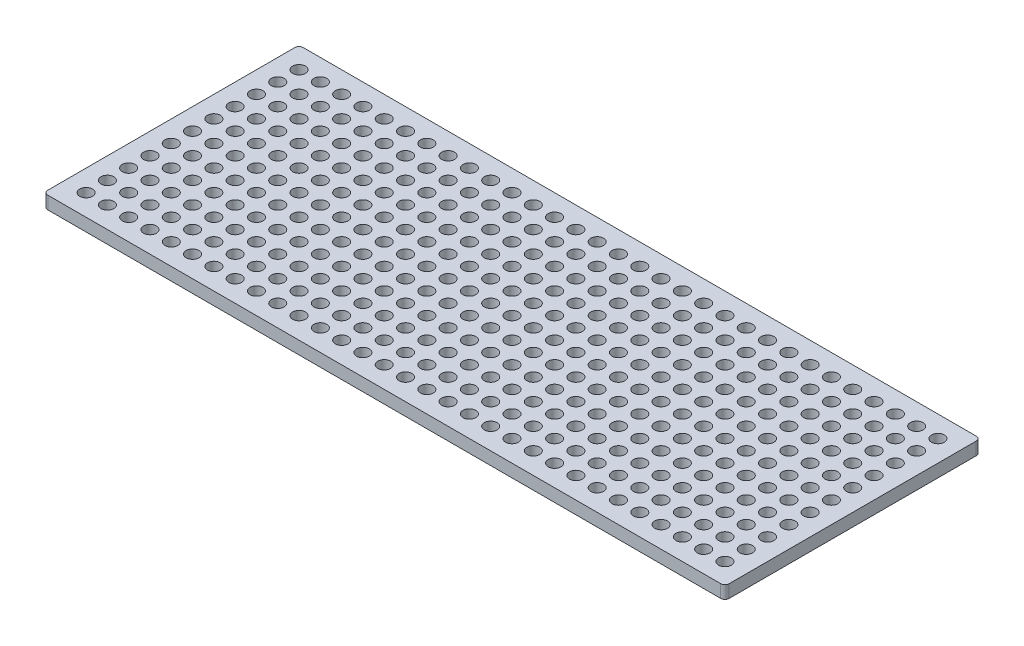
from build123d import *

# Parameters (mm, degrees)
SKETCH1_W           = 160
SKETCH1_H           = 60
SKETCH1_R           = 1.5
BOSS_EXTRUDE1_DEPTH = 3
FILLET2_R           = 1
FILLET3_R           = 1
FILLET4_R           = 1
FILLET5_R           = 1


with BuildPart() as part:
    # Sketch1 → Boss-Extrude1 (new body)
    with BuildSketch(Plane(origin=(0, 0, 0), x_dir=(1, 0, 0), z_dir=(0, 1, 0))):
        Rectangle(SKETCH1_W, SKETCH1_H)
        with Locations((-75, 25)):
            Circle(SKETCH1_R, mode=Mode.SUBTRACT)
        with Locations((-70, 25)):
            Circle(SKETCH1_R, mode=Mode.SUBTRACT)
        with Locations((-65, 25)):
            Circle(SKETCH1_R, mode=Mode.SUBTRACT)
        with Locations((-60, 25)):
            Circle(SKETCH1_R, mode=Mode.SUBTRACT)
        with Locations((-55, 25)):
            Circle(SKETCH1_R, mode=Mode.SUBTRACT)
        with Locations((-50, 25)):
            Circle(SKETCH1_R, mode=Mode.SUBTRACT)
        with Locations((-45, 25)):
            Circle(SKETCH1_R, mode=Mode.SUBTRACT)
        with Locations((-40, 25)):
            Circle(SKETCH1_R, mode=Mode.SUBTRACT)
        with Locations((-35, 25)):
            Circle(SKETCH1_R, mode=Mode.SUBTRACT)
        with Locations((-30, 25)):
            Circle(SKETCH1_R, mode=Mode.SUBTRACT)
        with Locations((-25, 25)):
            Circle(SKETCH1_R, mode=Mode.SUBTRACT)
        with Locations((-20, 25)):
            Circle(SKETCH1_R, mode=Mode.SUBTRACT)
        with Locations((-15, 25)):
            Circle(SKETCH1_R, mode=Mode.SUBTRACT)
        with Locations((-10, 25)):
            Circle(SKETCH1_R, mode=Mode.SUBTRACT)
        with Locations((-5, 25)):
            Circle(SKETCH1_R, mode=Mode.SUBTRACT)
        with Locations((0, 25)):
            Circle(SKETCH1_R, mode=Mode.SUBTRACT)
        with Locations((5, 25)):
            Circle(SKETCH1_R, mode=Mode.SUBTRACT)
        with Locations((10, 25)):
            Circle(SKETCH1_R, mode=Mode.SUBTRACT)
        with Locations((15, 25)):
            Circle(SKETCH1_R, mode=Mode.SUBTRACT)
        with Locations((20, 25)):
            Circle(SKETCH1_R, mode=Mode.SUBTRACT)
        with Locations((25, 25)):
            Circle(SKETCH1_R, mode=Mode.SUBTRACT)
        with Locations((30, 25)):
            Circle(SKETCH1_R, mode=Mode.SUBTRACT)
        with Locations((35, 25)):
            Circle(SKETCH1_R, mode=Mode.SUBTRACT)
        with Locations((40, 25)):
            Circle(SKETCH1_R, mode=Mode.SUBTRACT)
        with Locations((45, 25)):
            Circle(SKETCH1_R, mode=Mode.SUBTRACT)
        with Locations((50, 25)):
            Circle(SKETCH1_R, mode=Mode.SUBTRACT)
        with Locations((55, 25)):
            Circle(SKETCH1_R, mode=Mode.SUBTRACT)
        with Locations((60, 25)):
            Circle(SKETCH1_R, mode=Mode.SUBTRACT)
        with Locations((65, 25)):
            Circle(SKETCH1_R, mode=Mode.SUBTRACT)
        with Locations((70, 25)):
            Circle(SKETCH1_R, mode=Mode.SUBTRACT)
        with Locations((75, 25)):
            Circle(SKETCH1_R, mode=Mode.SUBTRACT)
        with Locations((-75, 20)):
            Circle(SKETCH1_R, mode=Mode.SUBTRACT)
        with Locations((-75, 15)):
            Circle(SKETCH1_R, mode=Mode.SUBTRACT)
        with Locations((-75, 10)):
            Circle(SKETCH1_R, mode=Mode.SUBTRACT)
        with Locations((-75, 5)):
            Circle(SKETCH1_R, mode=Mode.SUBTRACT)
        with Locations((-75, 0)):
            Circle(SKETCH1_R, mode=Mode.SUBTRACT)
        with Locations((-75, -5)):
            Circle(SKETCH1_R, mode=Mode.SUBTRACT)
        with Locations((-75, -10)):
            Circle(SKETCH1_R, mode=Mode.SUBTRACT)
        with Locations((-75, -15)):
            Circle(SKETCH1_R, mode=Mode.SUBTRACT)
        with Locations((-75, -20)):
            Circle(SKETCH1_R, mode=Mode.SUBTRACT)
        with Locations((-75, -25)):
            Circle(SKETCH1_R, mode=Mode.SUBTRACT)
        with Locations((-70, 20)):
            Circle(SKETCH1_R, mode=Mode.SUBTRACT)
        with Locations((-70, 10)):
            Circle(SKETCH1_R, mode=Mode.SUBTRACT)
        with Locations((-70, 5)):
            Circle(SKETCH1_R, mode=Mode.SUBTRACT)
        with Locations((-70, 0)):
            Circle(SKETCH1_R, mode=Mode.SUBTRACT)
        with Locations((-70, -5)):
            Circle(SKETCH1_R, mode=Mode.SUBTRACT)
        with Locations((-70, -10)):
            Circle(SKETCH1_R, mode=Mode.SUBTRACT)
        with Locations((-70, -15)):
            Circle(SKETCH1_R, mode=Mode.SUBTRACT)
        with Locations((-70, -20)):
            Circle(SKETCH1_R, mode=Mode.SUBTRACT)
        with Locations((-70, -25)):
            Circle(SKETCH1_R, mode=Mode.SUBTRACT)
        with Locations((-65, 20)):
            Circle(SKETCH1_R, mode=Mode.SUBTRACT)
        with Locations((-65, 10)):
            Circle(SKETCH1_R, mode=Mode.SUBTRACT)
        with Locations((-65, 5)):
            Circle(SKETCH1_R, mode=Mode.SUBTRACT)
        with Locations((-65, 0)):
            Circle(SKETCH1_R, mode=Mode.SUBTRACT)
        with Locations((-65, -5)):
            Circle(SKETCH1_R, mode=Mode.SUBTRACT)
        with Locations((-65, -10)):
            Circle(SKETCH1_R, mode=Mode.SUBTRACT)
        with Locations((-65, -15)):
            Circle(SKETCH1_R, mode=Mode.SUBTRACT)
        with Locations((-65, -20)):
            Circle(SKETCH1_R, mode=Mode.SUBTRACT)
        with Locations((-65, -25)):
            Circle(SKETCH1_R, mode=Mode.SUBTRACT)
        with Locations((-60, 20)):
            Circle(SKETCH1_R, mode=Mode.SUBTRACT)
        with Locations((-60, 10)):
            Circle(SKETCH1_R, mode=Mode.SUBTRACT)
        with Locations((-60, 5)):
            Circle(SKETCH1_R, mode=Mode.SUBTRACT)
        with Locations((-60, 0)):
            Circle(SKETCH1_R, mode=Mode.SUBTRACT)
        with Locations((-60, -5)):
            Circle(SKETCH1_R, mode=Mode.SUBTRACT)
        with Locations((-60, -10)):
            Circle(SKETCH1_R, mode=Mode.SUBTRACT)
        with Locations((-60, -15)):
            Circle(SKETCH1_R, mode=Mode.SUBTRACT)
        with Locations((-60, -20)):
            Circle(SKETCH1_R, mode=Mode.SUBTRACT)
        with Locations((-60, -25)):
            Circle(SKETCH1_R, mode=Mode.SUBTRACT)
        with Locations((-55, 20)):
            Circle(SKETCH1_R, mode=Mode.SUBTRACT)
        with Locations((-55, 10)):
            Circle(SKETCH1_R, mode=Mode.SUBTRACT)
        with Locations((-55, 5)):
            Circle(SKETCH1_R, mode=Mode.SUBTRACT)
        with Locations((-55, 0)):
            Circle(SKETCH1_R, mode=Mode.SUBTRACT)
        with Locations((-55, -5)):
            Circle(SKETCH1_R, mode=Mode.SUBTRACT)
        with Locations((-55, -10)):
            Circle(SKETCH1_R, mode=Mode.SUBTRACT)
        with Locations((-55, -15)):
            Circle(SKETCH1_R, mode=Mode.SUBTRACT)
        with Locations((-55, -20)):
            Circle(SKETCH1_R, mode=Mode.SUBTRACT)
        with Locations((-55, -25)):
            Circle(SKETCH1_R, mode=Mode.SUBTRACT)
        with Locations((-50, 20)):
            Circle(SKETCH1_R, mode=Mode.SUBTRACT)
        with Locations((-50, 10)):
            Circle(SKETCH1_R, mode=Mode.SUBTRACT)
        with Locations((-50, 5)):
            Circle(SKETCH1_R, mode=Mode.SUBTRACT)
        with Locations((-50, 0)):
            Circle(SKETCH1_R, mode=Mode.SUBTRACT)
        with Locations((-50, -5)):
            Circle(SKETCH1_R, mode=Mode.SUBTRACT)
        with Locations((-50, -10)):
            Circle(SKETCH1_R, mode=Mode.SUBTRACT)
        with Locations((-50, -15)):
            Circle(SKETCH1_R, mode=Mode.SUBTRACT)
        with Locations((-50, -20)):
            Circle(SKETCH1_R, mode=Mode.SUBTRACT)
        with Locations((-50, -25)):
            Circle(SKETCH1_R, mode=Mode.SUBTRACT)
        with Locations((-45, 20)):
            Circle(SKETCH1_R, mode=Mode.SUBTRACT)
        with Locations((-45, 10)):
            Circle(SKETCH1_R, mode=Mode.SUBTRACT)
        with Locations((-45, 5)):
            Circle(SKETCH1_R, mode=Mode.SUBTRACT)
        with Locations((-45, 0)):
            Circle(SKETCH1_R, mode=Mode.SUBTRACT)
        with Locations((-45, -5)):
            Circle(SKETCH1_R, mode=Mode.SUBTRACT)
        with Locations((-45, -10)):
            Circle(SKETCH1_R, mode=Mode.SUBTRACT)
        with Locations((-45, -15)):
            Circle(SKETCH1_R, mode=Mode.SUBTRACT)
        with Locations((-45, -20)):
            Circle(SKETCH1_R, mode=Mode.SUBTRACT)
        with Locations((-45, -25)):
            Circle(SKETCH1_R, mode=Mode.SUBTRACT)
        with Locations((-40, 20)):
            Circle(SKETCH1_R, mode=Mode.SUBTRACT)
        with Locations((-40, 10)):
            Circle(SKETCH1_R, mode=Mode.SUBTRACT)
        with Locations((-40, 5)):
            Circle(SKETCH1_R, mode=Mode.SUBTRACT)
        with Locations((-40, 0)):
            Circle(SKETCH1_R, mode=Mode.SUBTRACT)
        with Locations((-40, -5)):
            Circle(SKETCH1_R, mode=Mode.SUBTRACT)
        with Locations((-40, -10)):
            Circle(SKETCH1_R, mode=Mode.SUBTRACT)
        with Locations((-40, -15)):
            Circle(SKETCH1_R, mode=Mode.SUBTRACT)
        with Locations((-40, -20)):
            Circle(SKETCH1_R, mode=Mode.SUBTRACT)
        with Locations((-40, -25)):
            Circle(SKETCH1_R, mode=Mode.SUBTRACT)
        with Locations((-35, 20)):
            Circle(SKETCH1_R, mode=Mode.SUBTRACT)
        with Locations((-35, 10)):
            Circle(SKETCH1_R, mode=Mode.SUBTRACT)
        with Locations((-35, 5)):
            Circle(SKETCH1_R, mode=Mode.SUBTRACT)
        with Locations((-35, 0)):
            Circle(SKETCH1_R, mode=Mode.SUBTRACT)
        with Locations((-35, -5)):
            Circle(SKETCH1_R, mode=Mode.SUBTRACT)
        with Locations((-35, -10)):
            Circle(SKETCH1_R, mode=Mode.SUBTRACT)
        with Locations((-35, -15)):
            Circle(SKETCH1_R, mode=Mode.SUBTRACT)
        with Locations((-35, -20)):
            Circle(SKETCH1_R, mode=Mode.SUBTRACT)
        with Locations((-35, -25)):
            Circle(SKETCH1_R, mode=Mode.SUBTRACT)
        with Locations((-30, 20)):
            Circle(SKETCH1_R, mode=Mode.SUBTRACT)
        with Locations((-30, 10)):
            Circle(SKETCH1_R, mode=Mode.SUBTRACT)
        with Locations((-30, 5)):
            Circle(SKETCH1_R, mode=Mode.SUBTRACT)
        with Locations((-30, 0)):
            Circle(SKETCH1_R, mode=Mode.SUBTRACT)
        with Locations((-30, -5)):
            Circle(SKETCH1_R, mode=Mode.SUBTRACT)
        with Locations((-30, -10)):
            Circle(SKETCH1_R, mode=Mode.SUBTRACT)
        with Locations((-30, -15)):
            Circle(SKETCH1_R, mode=Mode.SUBTRACT)
        with Locations((-30, -20)):
            Circle(SKETCH1_R, mode=Mode.SUBTRACT)
        with Locations((-30, -25)):
            Circle(SKETCH1_R, mode=Mode.SUBTRACT)
        with Locations((-25, 20)):
            Circle(SKETCH1_R, mode=Mode.SUBTRACT)
        with Locations((-25, 10)):
            Circle(SKETCH1_R, mode=Mode.SUBTRACT)
        with Locations((-25, 5)):
            Circle(SKETCH1_R, mode=Mode.SUBTRACT)
        with Locations((-25, 0)):
            Circle(SKETCH1_R, mode=Mode.SUBTRACT)
        with Locations((-25, -5)):
            Circle(SKETCH1_R, mode=Mode.SUBTRACT)
        with Locations((-25, -10)):
            Circle(SKETCH1_R, mode=Mode.SUBTRACT)
        with Locations((-25, -15)):
            Circle(SKETCH1_R, mode=Mode.SUBTRACT)
        with Locations((-25, -20)):
            Circle(SKETCH1_R, mode=Mode.SUBTRACT)
        with Locations((-25, -25)):
            Circle(SKETCH1_R, mode=Mode.SUBTRACT)
        with Locations((-20, 20)):
            Circle(SKETCH1_R, mode=Mode.SUBTRACT)
        with Locations((-20, 10)):
            Circle(SKETCH1_R, mode=Mode.SUBTRACT)
        with Locations((-20, 5)):
            Circle(SKETCH1_R, mode=Mode.SUBTRACT)
        with Locations((-20, 0)):
            Circle(SKETCH1_R, mode=Mode.SUBTRACT)
        with Locations((-20, -5)):
            Circle(SKETCH1_R, mode=Mode.SUBTRACT)
        with Locations((-20, -10)):
            Circle(SKETCH1_R, mode=Mode.SUBTRACT)
        with Locations((-20, -15)):
            Circle(SKETCH1_R, mode=Mode.SUBTRACT)
        with Locations((-20, -20)):
            Circle(SKETCH1_R, mode=Mode.SUBTRACT)
        with Locations((-20, -25)):
            Circle(SKETCH1_R, mode=Mode.SUBTRACT)
        with Locations((-15, 20)):
            Circle(SKETCH1_R, mode=Mode.SUBTRACT)
        with Locations((-15, 10)):
            Circle(SKETCH1_R, mode=Mode.SUBTRACT)
        with Locations((-15, 5)):
            Circle(SKETCH1_R, mode=Mode.SUBTRACT)
        with Locations((-15, 0)):
            Circle(SKETCH1_R, mode=Mode.SUBTRACT)
        with Locations((-15, -5)):
            Circle(SKETCH1_R, mode=Mode.SUBTRACT)
        with Locations((-15, -10)):
            Circle(SKETCH1_R, mode=Mode.SUBTRACT)
        with Locations((-15, -15)):
            Circle(SKETCH1_R, mode=Mode.SUBTRACT)
        with Locations((-15, -20)):
            Circle(SKETCH1_R, mode=Mode.SUBTRACT)
        with Locations((-15, -25)):
            Circle(SKETCH1_R, mode=Mode.SUBTRACT)
        with Locations((-10, 20)):
            Circle(SKETCH1_R, mode=Mode.SUBTRACT)
        with Locations((-10, 10)):
            Circle(SKETCH1_R, mode=Mode.SUBTRACT)
        with Locations((-10, 5)):
            Circle(SKETCH1_R, mode=Mode.SUBTRACT)
        with Locations((-10, 0)):
            Circle(SKETCH1_R, mode=Mode.SUBTRACT)
        with Locations((-10, -5)):
            Circle(SKETCH1_R, mode=Mode.SUBTRACT)
        with Locations((-10, -10)):
            Circle(SKETCH1_R, mode=Mode.SUBTRACT)
        with Locations((-10, -15)):
            Circle(SKETCH1_R, mode=Mode.SUBTRACT)
        with Locations((-10, -20)):
            Circle(SKETCH1_R, mode=Mode.SUBTRACT)
        with Locations((-10, -25)):
            Circle(SKETCH1_R, mode=Mode.SUBTRACT)
        with Locations((-5, 20)):
            Circle(SKETCH1_R, mode=Mode.SUBTRACT)
        with Locations((-5, 10)):
            Circle(SKETCH1_R, mode=Mode.SUBTRACT)
        with Locations((-5, 5)):
            Circle(SKETCH1_R, mode=Mode.SUBTRACT)
        with Locations((-5, 0)):
            Circle(SKETCH1_R, mode=Mode.SUBTRACT)
        with Locations((-5, -5)):
            Circle(SKETCH1_R, mode=Mode.SUBTRACT)
        with Locations((-5, -10)):
            Circle(SKETCH1_R, mode=Mode.SUBTRACT)
        with Locations((-5, -15)):
            Circle(SKETCH1_R, mode=Mode.SUBTRACT)
        with Locations((-5, -20)):
            Circle(SKETCH1_R, mode=Mode.SUBTRACT)
        with Locations((-5, -25)):
            Circle(SKETCH1_R, mode=Mode.SUBTRACT)
        with Locations((0, 20)):
            Circle(SKETCH1_R, mode=Mode.SUBTRACT)
        with Locations((0, 10)):
            Circle(SKETCH1_R, mode=Mode.SUBTRACT)
        with Locations((0, 5)):
            Circle(SKETCH1_R, mode=Mode.SUBTRACT)
        Circle(SKETCH1_R, mode=Mode.SUBTRACT)
        with Locations((0, -5)):
            Circle(SKETCH1_R, mode=Mode.SUBTRACT)
        with Locations((0, -10)):
            Circle(SKETCH1_R, mode=Mode.SUBTRACT)
        with Locations((0, -15)):
            Circle(SKETCH1_R, mode=Mode.SUBTRACT)
        with Locations((0, -20)):
            Circle(SKETCH1_R, mode=Mode.SUBTRACT)
        with Locations((0, -25)):
            Circle(SKETCH1_R, mode=Mode.SUBTRACT)
        with Locations((5, 20)):
            Circle(SKETCH1_R, mode=Mode.SUBTRACT)
        with Locations((5, 10)):
            Circle(SKETCH1_R, mode=Mode.SUBTRACT)
        with Locations((5, 5)):
            Circle(SKETCH1_R, mode=Mode.SUBTRACT)
        with Locations((5, 0)):
            Circle(SKETCH1_R, mode=Mode.SUBTRACT)
        with Locations((5, -5)):
            Circle(SKETCH1_R, mode=Mode.SUBTRACT)
        with Locations((5, -10)):
            Circle(SKETCH1_R, mode=Mode.SUBTRACT)
        with Locations((5, -15)):
            Circle(SKETCH1_R, mode=Mode.SUBTRACT)
        with Locations((5, -20)):
            Circle(SKETCH1_R, mode=Mode.SUBTRACT)
        with Locations((5, -25)):
            Circle(SKETCH1_R, mode=Mode.SUBTRACT)
        with Locations((10, 20)):
            Circle(SKETCH1_R, mode=Mode.SUBTRACT)
        with Locations((10, 10)):
            Circle(SKETCH1_R, mode=Mode.SUBTRACT)
        with Locations((10, 5)):
            Circle(SKETCH1_R, mode=Mode.SUBTRACT)
        with Locations((10, 0)):
            Circle(SKETCH1_R, mode=Mode.SUBTRACT)
        with Locations((10, -5)):
            Circle(SKETCH1_R, mode=Mode.SUBTRACT)
        with Locations((10, -10)):
            Circle(SKETCH1_R, mode=Mode.SUBTRACT)
        with Locations((10, -15)):
            Circle(SKETCH1_R, mode=Mode.SUBTRACT)
        with Locations((10, -20)):
            Circle(SKETCH1_R, mode=Mode.SUBTRACT)
        with Locations((10, -25)):
            Circle(SKETCH1_R, mode=Mode.SUBTRACT)
        with Locations((15, 20)):
            Circle(SKETCH1_R, mode=Mode.SUBTRACT)
        with Locations((15, 10)):
            Circle(SKETCH1_R, mode=Mode.SUBTRACT)
        with Locations((15, 5)):
            Circle(SKETCH1_R, mode=Mode.SUBTRACT)
        with Locations((15, 0)):
            Circle(SKETCH1_R, mode=Mode.SUBTRACT)
        with Locations((15, -5)):
            Circle(SKETCH1_R, mode=Mode.SUBTRACT)
        with Locations((15, -10)):
            Circle(SKETCH1_R, mode=Mode.SUBTRACT)
        with Locations((15, -15)):
            Circle(SKETCH1_R, mode=Mode.SUBTRACT)
        with Locations((15, -20)):
            Circle(SKETCH1_R, mode=Mode.SUBTRACT)
        with Locations((15, -25)):
            Circle(SKETCH1_R, mode=Mode.SUBTRACT)
        with Locations((20, 20)):
            Circle(SKETCH1_R, mode=Mode.SUBTRACT)
        with Locations((20, 10)):
            Circle(SKETCH1_R, mode=Mode.SUBTRACT)
        with Locations((20, 5)):
            Circle(SKETCH1_R, mode=Mode.SUBTRACT)
        with Locations((20, 0)):
            Circle(SKETCH1_R, mode=Mode.SUBTRACT)
        with Locations((20, -5)):
            Circle(SKETCH1_R, mode=Mode.SUBTRACT)
        with Locations((20, -10)):
            Circle(SKETCH1_R, mode=Mode.SUBTRACT)
        with Locations((20, -15)):
            Circle(SKETCH1_R, mode=Mode.SUBTRACT)
        with Locations((20, -20)):
            Circle(SKETCH1_R, mode=Mode.SUBTRACT)
        with Locations((20, -25)):
            Circle(SKETCH1_R, mode=Mode.SUBTRACT)
        with Locations((25, 20)):
            Circle(SKETCH1_R, mode=Mode.SUBTRACT)
        with Locations((25, 10)):
            Circle(SKETCH1_R, mode=Mode.SUBTRACT)
        with Locations((25, 5)):
            Circle(SKETCH1_R, mode=Mode.SUBTRACT)
        with Locations((25, 0)):
            Circle(SKETCH1_R, mode=Mode.SUBTRACT)
        with Locations((25, -5)):
            Circle(SKETCH1_R, mode=Mode.SUBTRACT)
        with Locations((25, -10)):
            Circle(SKETCH1_R, mode=Mode.SUBTRACT)
        with Locations((25, -15)):
            Circle(SKETCH1_R, mode=Mode.SUBTRACT)
        with Locations((25, -20)):
            Circle(SKETCH1_R, mode=Mode.SUBTRACT)
        with Locations((25, -25)):
            Circle(SKETCH1_R, mode=Mode.SUBTRACT)
        with Locations((30, 20)):
            Circle(SKETCH1_R, mode=Mode.SUBTRACT)
        with Locations((30, 10)):
            Circle(SKETCH1_R, mode=Mode.SUBTRACT)
        with Locations((30, 5)):
            Circle(SKETCH1_R, mode=Mode.SUBTRACT)
        with Locations((30, 0)):
            Circle(SKETCH1_R, mode=Mode.SUBTRACT)
        with Locations((30, -5)):
            Circle(SKETCH1_R, mode=Mode.SUBTRACT)
        with Locations((30, -10)):
            Circle(SKETCH1_R, mode=Mode.SUBTRACT)
        with Locations((30, -15)):
            Circle(SKETCH1_R, mode=Mode.SUBTRACT)
        with Locations((30, -20)):
            Circle(SKETCH1_R, mode=Mode.SUBTRACT)
        with Locations((30, -25)):
            Circle(SKETCH1_R, mode=Mode.SUBTRACT)
        with Locations((35, 20)):
            Circle(SKETCH1_R, mode=Mode.SUBTRACT)
        with Locations((35, 10)):
            Circle(SKETCH1_R, mode=Mode.SUBTRACT)
        with Locations((35, 5)):
            Circle(SKETCH1_R, mode=Mode.SUBTRACT)
        with Locations((35, 0)):
            Circle(SKETCH1_R, mode=Mode.SUBTRACT)
        with Locations((35, -5)):
            Circle(SKETCH1_R, mode=Mode.SUBTRACT)
        with Locations((35, -10)):
            Circle(SKETCH1_R, mode=Mode.SUBTRACT)
        with Locations((35, -15)):
            Circle(SKETCH1_R, mode=Mode.SUBTRACT)
        with Locations((35, -20)):
            Circle(SKETCH1_R, mode=Mode.SUBTRACT)
        with Locations((35, -25)):
            Circle(SKETCH1_R, mode=Mode.SUBTRACT)
        with Locations((40, 20)):
            Circle(SKETCH1_R, mode=Mode.SUBTRACT)
        with Locations((40, 10)):
            Circle(SKETCH1_R, mode=Mode.SUBTRACT)
        with Locations((40, 5)):
            Circle(SKETCH1_R, mode=Mode.SUBTRACT)
        with Locations((40, 0)):
            Circle(SKETCH1_R, mode=Mode.SUBTRACT)
        with Locations((40, -5)):
            Circle(SKETCH1_R, mode=Mode.SUBTRACT)
        with Locations((40, -10)):
            Circle(SKETCH1_R, mode=Mode.SUBTRACT)
        with Locations((40, -15)):
            Circle(SKETCH1_R, mode=Mode.SUBTRACT)
        with Locations((40, -20)):
            Circle(SKETCH1_R, mode=Mode.SUBTRACT)
        with Locations((40, -25)):
            Circle(SKETCH1_R, mode=Mode.SUBTRACT)
        with Locations((45, 20)):
            Circle(SKETCH1_R, mode=Mode.SUBTRACT)
        with Locations((45, 10)):
            Circle(SKETCH1_R, mode=Mode.SUBTRACT)
        with Locations((45, 5)):
            Circle(SKETCH1_R, mode=Mode.SUBTRACT)
        with Locations((45, 0)):
            Circle(SKETCH1_R, mode=Mode.SUBTRACT)
        with Locations((45, -5)):
            Circle(SKETCH1_R, mode=Mode.SUBTRACT)
        with Locations((45, -10)):
            Circle(SKETCH1_R, mode=Mode.SUBTRACT)
        with Locations((45, -15)):
            Circle(SKETCH1_R, mode=Mode.SUBTRACT)
        with Locations((45, -20)):
            Circle(SKETCH1_R, mode=Mode.SUBTRACT)
        with Locations((45, -25)):
            Circle(SKETCH1_R, mode=Mode.SUBTRACT)
        with Locations((50, 20)):
            Circle(SKETCH1_R, mode=Mode.SUBTRACT)
        with Locations((50, 10)):
            Circle(SKETCH1_R, mode=Mode.SUBTRACT)
        with Locations((50, 5)):
            Circle(SKETCH1_R, mode=Mode.SUBTRACT)
        with Locations((50, 0)):
            Circle(SKETCH1_R, mode=Mode.SUBTRACT)
        with Locations((50, -5)):
            Circle(SKETCH1_R, mode=Mode.SUBTRACT)
        with Locations((50, -10)):
            Circle(SKETCH1_R, mode=Mode.SUBTRACT)
        with Locations((50, -15)):
            Circle(SKETCH1_R, mode=Mode.SUBTRACT)
        with Locations((50, -20)):
            Circle(SKETCH1_R, mode=Mode.SUBTRACT)
        with Locations((50, -25)):
            Circle(SKETCH1_R, mode=Mode.SUBTRACT)
        with Locations((55, 20)):
            Circle(SKETCH1_R, mode=Mode.SUBTRACT)
        with Locations((55, 10)):
            Circle(SKETCH1_R, mode=Mode.SUBTRACT)
        with Locations((55, 5)):
            Circle(SKETCH1_R, mode=Mode.SUBTRACT)
        with Locations((55, 0)):
            Circle(SKETCH1_R, mode=Mode.SUBTRACT)
        with Locations((55, -5)):
            Circle(SKETCH1_R, mode=Mode.SUBTRACT)
        with Locations((55, -10)):
            Circle(SKETCH1_R, mode=Mode.SUBTRACT)
        with Locations((55, -15)):
            Circle(SKETCH1_R, mode=Mode.SUBTRACT)
        with Locations((55, -20)):
            Circle(SKETCH1_R, mode=Mode.SUBTRACT)
        with Locations((55, -25)):
            Circle(SKETCH1_R, mode=Mode.SUBTRACT)
        with Locations((60, 20)):
            Circle(SKETCH1_R, mode=Mode.SUBTRACT)
        with Locations((60, 10)):
            Circle(SKETCH1_R, mode=Mode.SUBTRACT)
        with Locations((60, 5)):
            Circle(SKETCH1_R, mode=Mode.SUBTRACT)
        with Locations((60, 0)):
            Circle(SKETCH1_R, mode=Mode.SUBTRACT)
        with Locations((60, -5)):
            Circle(SKETCH1_R, mode=Mode.SUBTRACT)
        with Locations((60, -10)):
            Circle(SKETCH1_R, mode=Mode.SUBTRACT)
        with Locations((60, -15)):
            Circle(SKETCH1_R, mode=Mode.SUBTRACT)
        with Locations((60, -20)):
            Circle(SKETCH1_R, mode=Mode.SUBTRACT)
        with Locations((60, -25)):
            Circle(SKETCH1_R, mode=Mode.SUBTRACT)
        with Locations((65, 20)):
            Circle(SKETCH1_R, mode=Mode.SUBTRACT)
        with Locations((65, 10)):
            Circle(SKETCH1_R, mode=Mode.SUBTRACT)
        with Locations((65, 5)):
            Circle(SKETCH1_R, mode=Mode.SUBTRACT)
        with Locations((65, 0)):
            Circle(SKETCH1_R, mode=Mode.SUBTRACT)
        with Locations((65, -5)):
            Circle(SKETCH1_R, mode=Mode.SUBTRACT)
        with Locations((65, -10)):
            Circle(SKETCH1_R, mode=Mode.SUBTRACT)
        with Locations((65, -15)):
            Circle(SKETCH1_R, mode=Mode.SUBTRACT)
        with Locations((65, -20)):
            Circle(SKETCH1_R, mode=Mode.SUBTRACT)
        with Locations((65, -25)):
            Circle(SKETCH1_R, mode=Mode.SUBTRACT)
        with Locations((70, 20)):
            Circle(SKETCH1_R, mode=Mode.SUBTRACT)
        with Locations((70, 10)):
            Circle(SKETCH1_R, mode=Mode.SUBTRACT)
        with Locations((70, 5)):
            Circle(SKETCH1_R, mode=Mode.SUBTRACT)
        with Locations((70, 0)):
            Circle(SKETCH1_R, mode=Mode.SUBTRACT)
        with Locations((70, -5)):
            Circle(SKETCH1_R, mode=Mode.SUBTRACT)
        with Locations((70, -10)):
            Circle(SKETCH1_R, mode=Mode.SUBTRACT)
        with Locations((70, -15)):
            Circle(SKETCH1_R, mode=Mode.SUBTRACT)
        with Locations((70, -20)):
            Circle(SKETCH1_R, mode=Mode.SUBTRACT)
        with Locations((70, -25)):
            Circle(SKETCH1_R, mode=Mode.SUBTRACT)
        with Locations((75, 20)):
            Circle(SKETCH1_R, mode=Mode.SUBTRACT)
        with Locations((75, 10)):
            Circle(SKETCH1_R, mode=Mode.SUBTRACT)
        with Locations((75, 5)):
            Circle(SKETCH1_R, mode=Mode.SUBTRACT)
        with Locations((75, 0)):
            Circle(SKETCH1_R, mode=Mode.SUBTRACT)
        with Locations((75, -5)):
            Circle(SKETCH1_R, mode=Mode.SUBTRACT)
        with Locations((75, -10)):
            Circle(SKETCH1_R, mode=Mode.SUBTRACT)
        with Locations((75, -15)):
            Circle(SKETCH1_R, mode=Mode.SUBTRACT)
        with Locations((75, -20)):
            Circle(SKETCH1_R, mode=Mode.SUBTRACT)
        with Locations((75, -25)):
            Circle(SKETCH1_R, mode=Mode.SUBTRACT)
        with Locations((-70, 15)):
            Circle(SKETCH1_R, mode=Mode.SUBTRACT)
        with Locations((-65, 15)):
            Circle(SKETCH1_R, mode=Mode.SUBTRACT)
        with Locations((-60, 15)):
            Circle(SKETCH1_R, mode=Mode.SUBTRACT)
        with Locations((-55, 15)):
            Circle(SKETCH1_R, mode=Mode.SUBTRACT)
        with Locations((-50, 15)):
            Circle(SKETCH1_R, mode=Mode.SUBTRACT)
        with Locations((-45, 15)):
            Circle(SKETCH1_R, mode=Mode.SUBTRACT)
        with Locations((-40, 15)):
            Circle(SKETCH1_R, mode=Mode.SUBTRACT)
        with Locations((-35, 15)):
            Circle(SKETCH1_R, mode=Mode.SUBTRACT)
        with Locations((-30, 15)):
            Circle(SKETCH1_R, mode=Mode.SUBTRACT)
        with Locations((-25, 15)):
            Circle(SKETCH1_R, mode=Mode.SUBTRACT)
        with Locations((-20, 15)):
            Circle(SKETCH1_R, mode=Mode.SUBTRACT)
        with Locations((-15, 15)):
            Circle(SKETCH1_R, mode=Mode.SUBTRACT)
        with Locations((-10, 15)):
            Circle(SKETCH1_R, mode=Mode.SUBTRACT)
        with Locations((-5, 15)):
            Circle(SKETCH1_R, mode=Mode.SUBTRACT)
        with Locations((0, 15)):
            Circle(SKETCH1_R, mode=Mode.SUBTRACT)
        with Locations((5, 15)):
            Circle(SKETCH1_R, mode=Mode.SUBTRACT)
        with Locations((10, 15)):
            Circle(SKETCH1_R, mode=Mode.SUBTRACT)
        with Locations((15, 15)):
            Circle(SKETCH1_R, mode=Mode.SUBTRACT)
        with Locations((20, 15)):
            Circle(SKETCH1_R, mode=Mode.SUBTRACT)
        with Locations((25, 15)):
            Circle(SKETCH1_R, mode=Mode.SUBTRACT)
        with Locations((30, 15)):
            Circle(SKETCH1_R, mode=Mode.SUBTRACT)
        with Locations((35, 15)):
            Circle(SKETCH1_R, mode=Mode.SUBTRACT)
        with Locations((40, 15)):
            Circle(SKETCH1_R, mode=Mode.SUBTRACT)
        with Locations((45, 15)):
            Circle(SKETCH1_R, mode=Mode.SUBTRACT)
        with Locations((50, 15)):
            Circle(SKETCH1_R, mode=Mode.SUBTRACT)
        with Locations((55, 15)):
            Circle(SKETCH1_R, mode=Mode.SUBTRACT)
        with Locations((60, 15)):
            Circle(SKETCH1_R, mode=Mode.SUBTRACT)
        with Locations((65, 15)):
            Circle(SKETCH1_R, mode=Mode.SUBTRACT)
        with Locations((70, 15)):
            Circle(SKETCH1_R, mode=Mode.SUBTRACT)
        with Locations((75, 15)):
            Circle(SKETCH1_R, mode=Mode.SUBTRACT)
    extrude(amount=BOSS_EXTRUDE1_DEPTH)

    # Fillet2
    fillet2_edges = [part.edges().sort_by_distance(p)[0] for p in [
        (-80, 1.5, 30),
    ]]
    fillet(fillet2_edges, radius=FILLET2_R)

    # Fillet3
    fillet3_edges = [part.edges().sort_by_distance(p)[0] for p in [
        (-80, 1.5, -30),
    ]]
    fillet(fillet3_edges, radius=FILLET3_R)

    # Fillet4
    fillet4_edges = [part.edges().sort_by_distance(p)[0] for p in [
        (80, 1.5, 30),
    ]]
    fillet(fillet4_edges, radius=FILLET4_R)

    # Fillet5
    fillet5_edges = [part.edges().sort_by_distance(p)[0] for p in [
        (80, 1.5, -30),
    ]]
    fillet(fillet5_edges, radius=FILLET5_R)


solid = part.part
